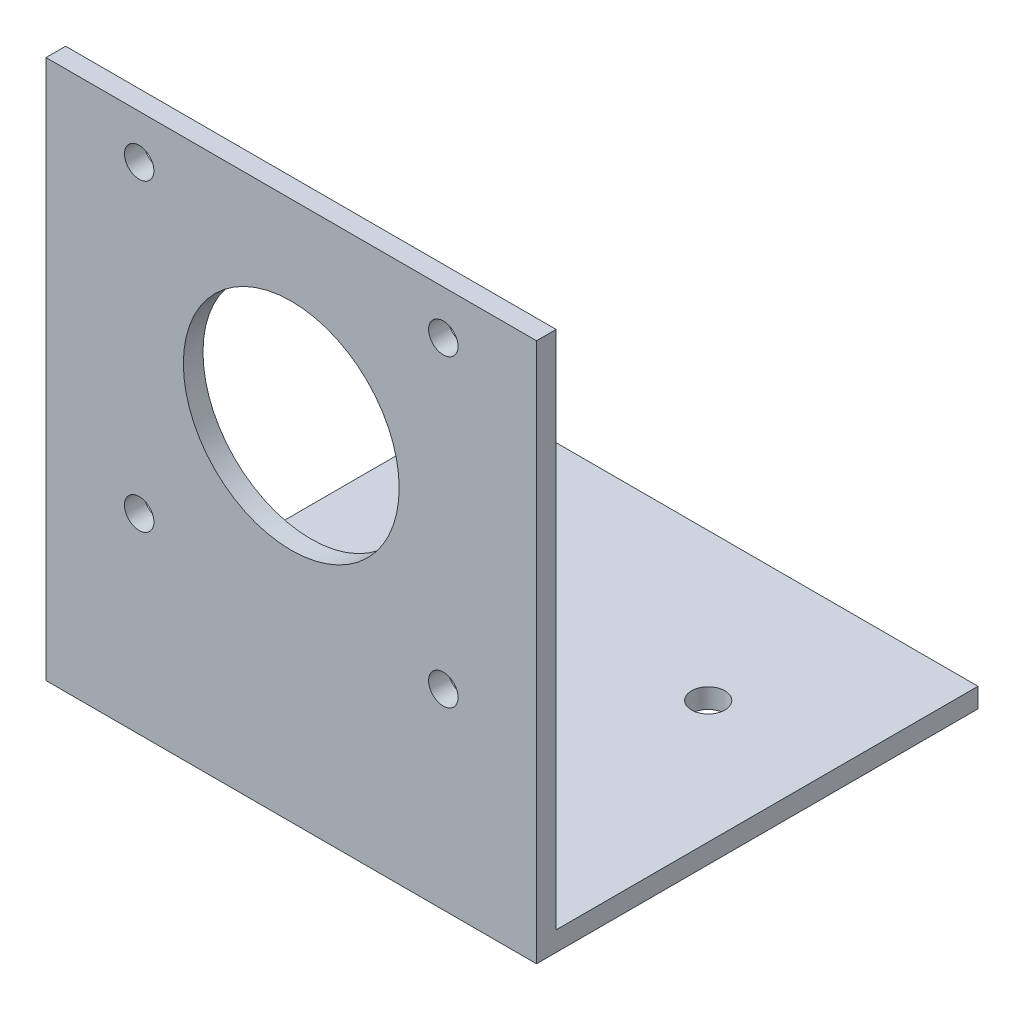
from build123d import *

# Parameters (mm, degrees)
SKETCH1_W                 = 50
SKETCH1_H                 = 55
BOSS_EXTRUDE1_DEPTH       = 2
SKETCH2_W                 = 50
SKETCH2_H                 = 2
BOSS_EXTRUDE2_DEPTH       = 45
CUT_EXTRUDE1_DEPTH        = 76.332595867
CUT_EXTRUDE1_DEPTH_BACK   = 76.332595867
SKETCH3_R                 = 1.5
LO_TAM_D22_DEPTH          = 76.332595867
LO_TAM_D22_DEPTH_BACK     = 76.332595867
SKETCH4_R                 = 11
HAI_LO_CHAN_M3_DEPTH      = 76.332595867
HAI_LO_CHAN_M3_DEPTH_BACK = 76.332595867
SKETCH5_R                 = 1.7


with BuildPart() as part:
    # Sketch1 → Boss-Extrude1 (new body)
    with BuildSketch(Plane.XY):
        with Locations((0, 27.5)):
            Rectangle(SKETCH1_W, SKETCH1_H)
    extrude(amount=-BOSS_EXTRUDE1_DEPTH)

    # Sketch2 → Boss-Extrude2 (add)
    with BuildSketch(Plane.XY):
        with Locations((0, 1)):
            Rectangle(SKETCH2_W, SKETCH2_H)
    extrude(amount=-BOSS_EXTRUDE2_DEPTH)

    # Sketch3 → Cut-Extrude1 (cut, two sides: drawn at the far end of the back side and taken through both)
    with BuildSketch(Plane.XY.offset(-CUT_EXTRUDE1_DEPTH_BACK)):
        with Locations((-15.5, 19.5)):
            Circle(SKETCH3_R)
        with Locations((-15.5, 50.5)):
            Circle(SKETCH3_R)
        with Locations((15.5, 19.5)):
            Circle(SKETCH3_R)
        with Locations((15.5, 50.5)):
            Circle(SKETCH3_R)
    extrude(amount=CUT_EXTRUDE1_DEPTH + CUT_EXTRUDE1_DEPTH_BACK, mode=Mode.SUBTRACT)

    # Sketch4 → Lo_tam_D22 (cut, two sides: drawn at the far end of the back side and taken through both)
    with BuildSketch(Plane.XY.offset(-LO_TAM_D22_DEPTH_BACK)):
        with Locations((0, 35)):
            Circle(SKETCH4_R)
    extrude(amount=LO_TAM_D22_DEPTH + LO_TAM_D22_DEPTH_BACK, mode=Mode.SUBTRACT)

    # Sketch5 → Hai_lo_chan_M3 (cut, two sides: drawn at the far end of the back side and taken through both)
    with BuildSketch(Plane(origin=(0, 0, 0), x_dir=(1, 0, 0), z_dir=(0, 1, 0)).offset(-HAI_LO_CHAN_M3_DEPTH_BACK)):
        with Locations((-12.5, 30)):
            Circle(SKETCH5_R)
        with Locations((12.5, 30)):
            Circle(SKETCH5_R)
    extrude(amount=HAI_LO_CHAN_M3_DEPTH + HAI_LO_CHAN_M3_DEPTH_BACK, mode=Mode.SUBTRACT)


solid = part.part
